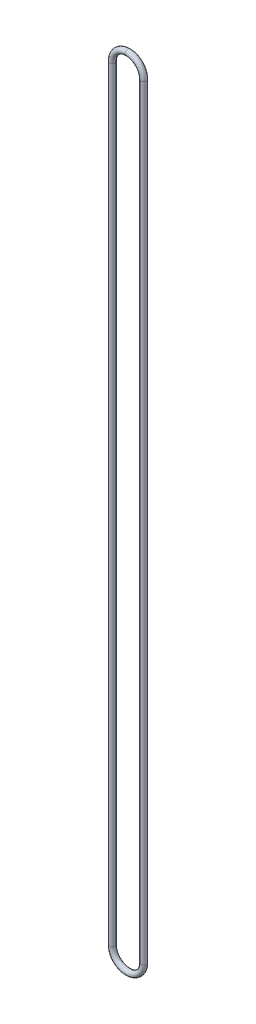
from build123d import *

# Parameters (mm, degrees)
SKETCH2_R = 3.175


with BuildPart() as part:
    # Sweep1: sweep along a path in Sketch1
    with BuildLine(Plane.XY) as sweep1_path:
        Line((-17.4625, 850.9), (-17.4625, 0))
        ThreePointArc((-17.4625, 0), (0, -17.4625), (17.4625, 0))
        Line((17.4625, 0), (17.4625, 850.9))
        ThreePointArc((17.4625, 850.9), (0, 868.3625), (-17.4625, 850.9))
    # Sketch2 → Sweep1 (sweep)
    with BuildSketch(Plane(origin=(0, 0, 0), x_dir=(0, 0, -1), z_dir=(1, 0, 0))):
        with Locations((0, 868.3625)):
            Circle(SKETCH2_R)
    sweep(path=sweep1_path.line)


solid = part.part
